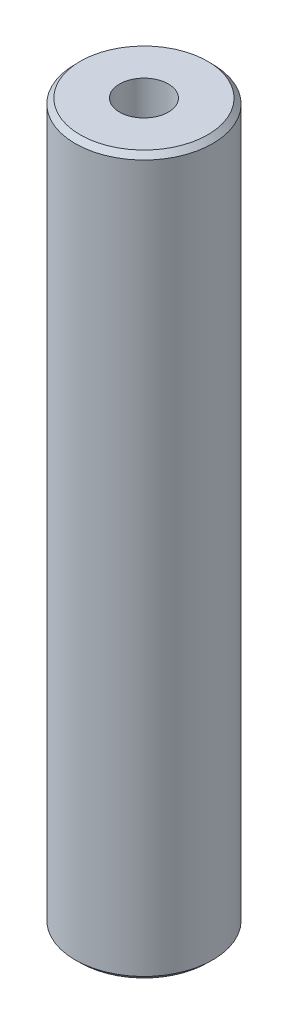
from build123d import *
from OCP.BRepFilletAPI import BRepFilletAPI_MakeChamfer

# Parameters (mm, degrees)
SKETCH1_R           = 57.5
BOSS_EXTRUDE1_DEPTH = 600
SKETCH2_R           = 20.430758571
CUT_EXTRUDE1_DEPTH  = 606.485342515
CHAMFER1_SIZE       = 4.287949046
CHAMFER1_SIZE2      = 4.167946493


with BuildPart() as part:
    # Sketch1 → Boss-Extrude1 (new body)
    with BuildSketch(Plane(origin=(0, 0, 0), x_dir=(1, 0, 0), z_dir=(0, 1, 0))):
        Circle(SKETCH1_R)
    extrude(amount=BOSS_EXTRUDE1_DEPTH)

    # Sketch2 → Cut-Extrude1 (cut, through all)
    with BuildSketch(Plane(origin=(0, 0, 0), x_dir=(1, 0, 0), z_dir=(0, 1, 0))):
        Circle(SKETCH2_R)
    extrude(amount=CUT_EXTRUDE1_DEPTH, mode=Mode.SUBTRACT)

    # Chamfer1: one chamfer whose edges measure the first distance from different faces: ONE call of the kernel's chamfer builder (chamfer() names one face for all edges)
    chamfer1_edges_1 = [part.edges().sort_by_distance(p)[0] for p in [
        (-57.5, 600, 0),
    ]]
    chamfer1_side_1 = [part.faces().sort_by_distance(p)[0] for p in [
        (-57.5, 300, 0),
    ]]
    chamfer1_edges_2 = [part.edges().sort_by_distance(p)[0] for p in [
        (-57.5, 0, 0),
    ]]
    chamfer1_side_2 = [part.faces().sort_by_distance(p)[0] for p in [
        (-55.873654403, 0, 0),
    ]]
    chamfer1 = BRepFilletAPI_MakeChamfer(part.part.solid().wrapped)
    for e in chamfer1_edges_1:
        chamfer1.Add(CHAMFER1_SIZE, CHAMFER1_SIZE2, e.wrapped, chamfer1_side_1[0].wrapped)  # the first distance lies on this face
    for e in chamfer1_edges_2:
        chamfer1.Add(CHAMFER1_SIZE, CHAMFER1_SIZE2, e.wrapped, chamfer1_side_2[0].wrapped)  # the first distance lies on this face
    add(Compound.cast(chamfer1.Shape()), mode=Mode.REPLACE)


solid = part.part
